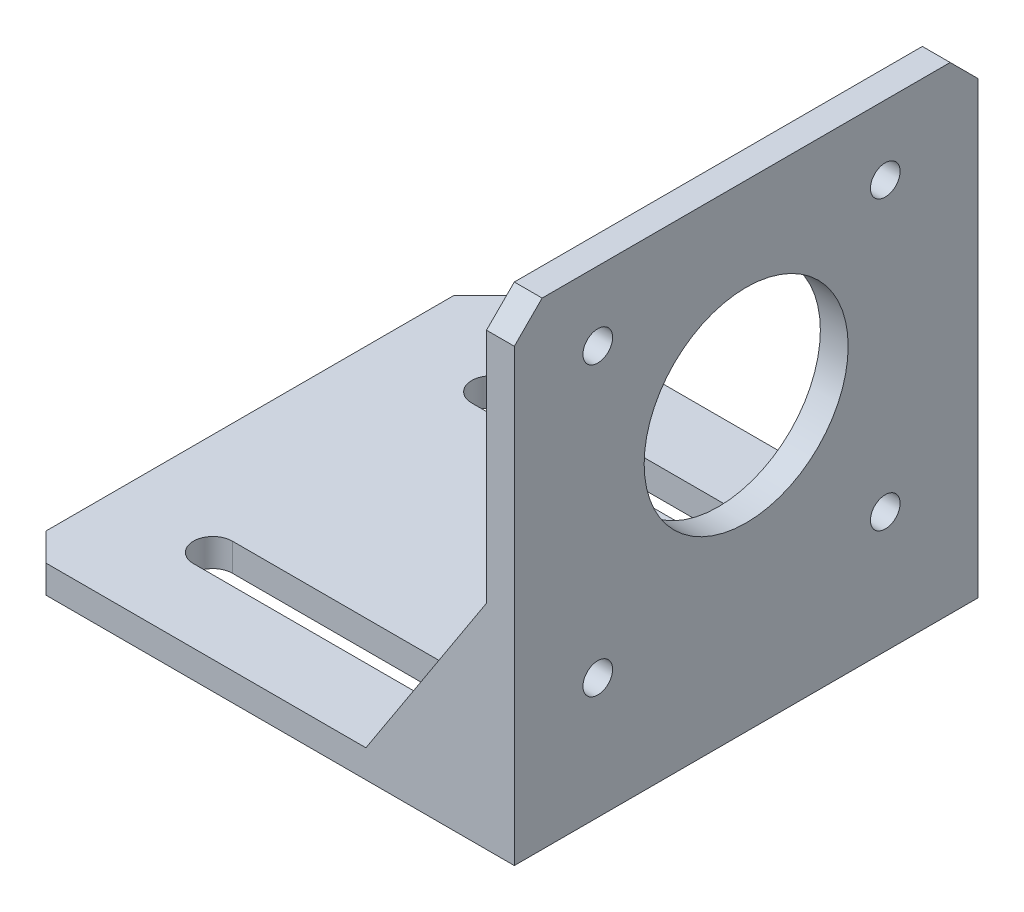
from build123d import *

# Parameters (mm, degrees)
EXTRUDE_1_DEPTH             = 50
HOLE_WIZARD_1_D             = 22
HOLE_WIZARD_1_DEPTH         = 100
HOLE_WIZARD_2_D             = 3.2
HOLE_WIZARD_2_DEPTH         = 100
HOLE_START                  = -3
HOLE_WIZARD_4_2_4_2_1_DEPTH = 3
RIB_1_REACH                 = 89.832
SKETCH_13_WALL_W            = 201.518173748
SKETCH_13_WALL_H            = 2.1
CHAMFER_1_SIZE              = 3


# Read off the part's stored shape, not the designer's step: Ø4.2 (4.2) 直径槽口1
with BuildPart() as part:
    # 草图1 → 凸台-拉伸1 (new body)
    with BuildSketch(Plane.XY):
        Polygon((0, 0), (50.5, 0), (50.5, 48.5), (53.5, 48.5), (53.5, -3), (0, -3), align=None)
    extrude(amount=EXTRUDE_1_DEPTH)

    # 孔1
    with Locations(Plane.ZY.offset(-50.5)):
        with Locations((25, 27.5)):
            Hole(HOLE_WIZARD_1_D / 2, depth=HOLE_WIZARD_1_DEPTH)

    # 孔2
    with Locations(Plane.ZY.offset(-50.5)):
        with Locations((10, 41.034802043), (41, 41.034802043), (41, 10.034802043), (10, 10.034802043)):
            Hole(HOLE_WIZARD_2_D / 2, depth=HOLE_WIZARD_2_DEPTH)

    # Ø4.2 (4.2) 直径槽口1 outline → Ø4.2 (4.2) 直径槽口1 (cut)
    with BuildSketch(Plane(origin=(0, 0, 0), x_dir=(1, 0, 0), z_dir=(0, 1, 0)).offset(HOLE_START)):
        with BuildLine():
            Line((11, -42.1), (41, -42.1))
            ThreePointArc((41, -42.1), (43.1, -40), (41, -37.9))
            Line((41, -37.9), (11, -37.9))
            ThreePointArc((11, -37.9), (8.9, -40), (11, -42.1))
        make_face()
        with BuildLine():
            Line((11, -12.1), (41, -12.1))
            ThreePointArc((41, -12.1), (43.1, -10), (41, -7.9))
            Line((41, -7.9), (11, -7.9))
            ThreePointArc((11, -7.9), (8.9, -10), (11, -12.1))
        make_face()
    extrude(amount=HOLE_WIZARD_4_2_4_2_1_DEPTH, mode=Mode.SUBTRACT)

    # 草图13 wall → 筋1 (add, up to next)
    with BuildSketch(Plane(origin=(44, 10, 50), x_dir=(-0.544988350595, -0.838443616301, 0), z_dir=(0.838443616301, -0.544988350595, 0)), mode=Mode.PRIVATE) as rib_1_sk1:
        with Locations((0, 1.05)):
            Rectangle(SKETCH_13_WALL_W, SKETCH_13_WALL_H)
    rib_1_tool1 = extrude(rib_1_sk1.sketch, amount=RIB_1_REACH, mode=Mode.PRIVATE) - part.part
    rib_1 = rib_1_tool1.solids().sort_by_distance((44, 10, 50))[0]
    add(rib_1)

    # 镜向1: 筋1 across plane
    add(rib_1.mirror(Plane.XY.offset(25)))

    # 倒角1
    chamfer_1_edges = [part.edges().sort_by_distance(p)[0] for p in [
        (52, 48.5, 50),
        (0, -1.5, 50),
        (52, 48.5, 0),
        (0, -1.5, 0),
    ]]
    chamfer(chamfer_1_edges, length=CHAMFER_1_SIZE)


solid = part.part
